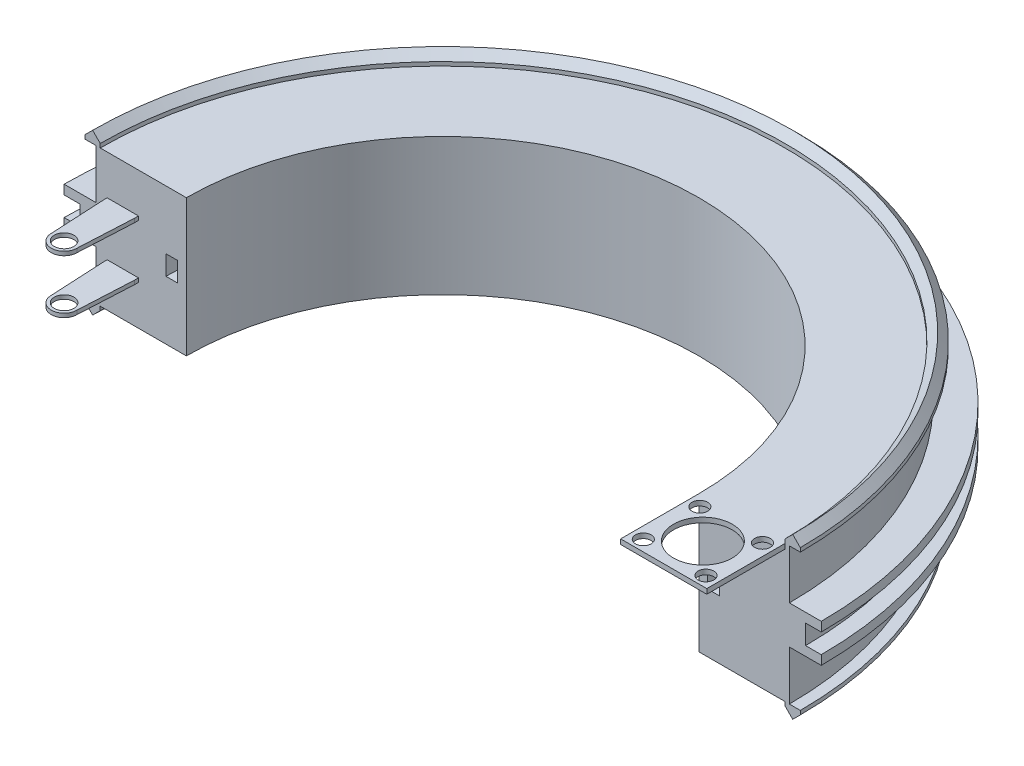
from build123d import *

# Parameters (mm, degrees)
SKETCH1_W           = 3
SKETCH1_H           = 4.999999988
SKETCH13_W          = 8
SKETCH13_H          = 1
BOSS_EXTRUDE1_DEPTH = 1
SKETCH15_R          = 2.5
BOSS_EXTRUDE4_DEPTH = 1
SKETCH17_W          = 22
SKETCH17_H          = 1.258125847
BOSS_EXTRUDE5_DEPTH = 20
SKETCH18_R          = 7.5
SKETCH18_R_2        = 2
CUT_EXTRUDE2_DEPTH  = 2


with BuildPart() as part:
    # Sweep3: sweep along a path in Sketch3
    with BuildLine(Plane(origin=(0, 0, 0), x_dir=(1, 0, 0), z_dir=(0, 1, 0))) as sweep3_path:
        ThreePointArc((0, 0), (65.459977148, 65.459977148), (130.919954296, 0))
    # Sketch1 → Sweep3 (sweep)
    with BuildSketch(Plane.XY):
        Polygon((0, 22.142579535), (0, -12.857420465), (-22, -12.857420465), (-22, -13.857420465), (-23.944543648, -15.801964114), (-25.889087297, -13.857420465), (-25.889087297, -12.857420465), (-23.090911996, -12.857420465), (-23.090911996, -0.233497298), (-31.231195924, -0.233497298), (-31.231195924, 2.142579535), (-27.231195924, 2.142579535), (-27.231195924, 7.142579535), (-31.231195924, 7.142579535), (-31.231195924, 9.518656368), (-23.090911996, 9.518656368), (-23.090911996, 22.142579535), (-25.889087297, 22.142579535), (-25.889087297, 23.142579535), (-23.944543648, 25.087123183), (-22, 23.142579535), (-22, 22.142579535), align=None)
        with Locations((-3.731195924, 4.642579541)):
            Rectangle(SKETCH1_W, SKETCH1_H, mode=Mode.SUBTRACT)
    sweep(path=sweep3_path.line)

    # Sketch13 → Boss-Extrude1 (add)
    with BuildSketch(Plane.XY):
        with Locations((-16.231195924, 11.492579541)):
            Rectangle(SKETCH13_W, SKETCH13_H)
        with Locations((-16.231195924, -2.207420459)):
            Rectangle(SKETCH13_W, SKETCH13_H)
    boss_extrude1 = extrude(amount=BOSS_EXTRUDE1_DEPTH)

    # Sketch15 → Boss-Extrude4 (add)
    with BuildSketch(Plane(origin=(0, 11.992579541, 0), x_dir=(1, 0, 0), z_dir=(0, 1, 0))):
        with BuildLine():
            Line((-20.231195924, -1), (-19.505374764, -15))
            ThreePointArc((-19.505374764, -15), (-16.231195924, -18.27417884), (-12.957017084, -15))
            Line((-12.957017084, -15), (-12.231195924, -1))
            Line((-12.231195924, -1), (-20.231195924, -1))
        make_face()
        with Locations((-16.231195924, -15)):
            Circle(SKETCH15_R, mode=Mode.SUBTRACT)
    boss_extrude4 = extrude(amount=-BOSS_EXTRUDE4_DEPTH)

    # Mirror3: Boss-Extrude1, Boss-Extrude4 across plane
    add(boss_extrude1.mirror(Plane.ZX.offset(4.642579535)))
    add(boss_extrude4.mirror(Plane.ZX.offset(4.642579535)))

    # Sketch17 → Boss-Extrude5 (add)
    with BuildSketch(Plane.XY):
        with Locations((141.919954296, 21.513516612)):
            Rectangle(SKETCH17_W, SKETCH17_H)
    extrude(amount=BOSS_EXTRUDE5_DEPTH)

    # Sketch18 → Cut-Extrude2 (cut)
    with BuildSketch(Plane.XZ.offset(-20.884453688)):
        with Locations((141.919954296, 10)):
            Circle(SKETCH18_R)
        with Locations((133.923048269, 17.217099268)):
            Circle(SKETCH18_R_2)
        with Locations((149.916860322, 17.217099268)):
            Circle(SKETCH18_R_2)
        with Locations((133.923048269, 2.782900732)):
            Circle(SKETCH18_R_2)
        with Locations((149.916860322, 2.782900732)):
            Circle(SKETCH18_R_2)
    extrude(amount=-CUT_EXTRUDE2_DEPTH, mode=Mode.SUBTRACT)


solid = part.part
